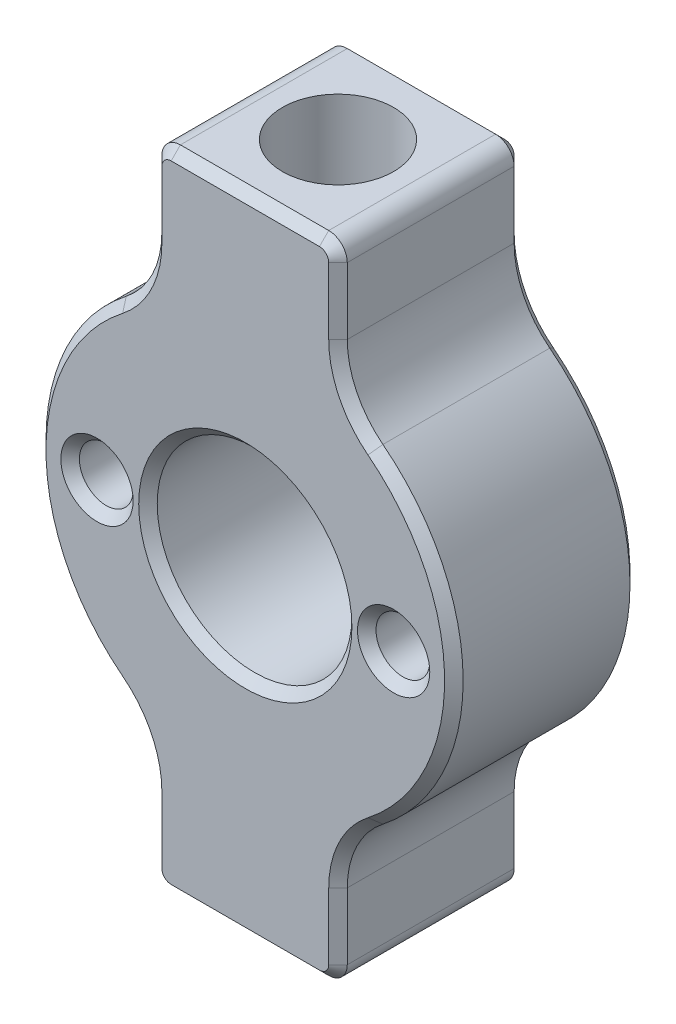
from build123d import *

# Parameters (mm, degrees)
SKIZZE1_R                       = 11.25
SKIZZE1_R_2                     = 5.25
AUFSATZ_LINEAR_AUSTRAGEN1_DEPTH = 10
AUFSATZ_LINEAR_START            = 6
SKIZZE2_W                       = 10
SKIZZE2_H                       = 10
AUFSATZ_LINEAR_AUSTRAGEN2_DEPTH = 11.4
SKIZZE3_R                       = 3
SCHNITT_LINEAR_AUSTRAGEN1_DEPTH = 10
SKIZZE4_R                       = 1.45
SCHNITT_LINEAR_AUSTRAGEN2_DEPTH = 8
VERRUNDUNG2_R                   = 5
VERRUNDUNG1_R                   = 1
FASE1_SIZE                      = 0.5


with BuildPart() as part:
    # Skizze1 → Aufsatz-Linear austragen1 (new body)
    with BuildSketch(Plane.XY):
        Circle(SKIZZE1_R)
        Circle(SKIZZE1_R_2, mode=Mode.SUBTRACT)
    extrude(amount=AUFSATZ_LINEAR_AUSTRAGEN1_DEPTH)

    # Skizze2 → Aufsatz-Linear austragen2 (add)
    with BuildSketch(Plane(origin=(0, 0, 0), x_dir=(1, 0, 0), z_dir=(0, 1, 0)).offset(AUFSATZ_LINEAR_START)):
        with Locations((0, -5)):
            Rectangle(SKIZZE2_W, SKIZZE2_H)
    aufsatz_linear_austragen2 = extrude(amount=AUFSATZ_LINEAR_AUSTRAGEN2_DEPTH)

    # Skizze3 → Schnitt-Linear austragen1 (cut)
    with BuildSketch(Plane(origin=(0, 17.4, 0), x_dir=(1, 0, 0), z_dir=(0, 1, 0))):
        with Locations((0, -5)):
            Circle(SKIZZE3_R)
    schnitt_linear_austragen1 = extrude(amount=-SCHNITT_LINEAR_AUSTRAGEN1_DEPTH, mode=Mode.SUBTRACT)

    # Spiegeln1: Aufsatz-Linear austragen2, Schnitt-Linear austragen1 across plane
    add(aufsatz_linear_austragen2.mirror(Plane.ZX))
    add(schnitt_linear_austragen1.mirror(Plane.ZX), mode=Mode.SUBTRACT)

    # Skizze4 → Schnitt-Linear austragen2 (cut)
    with BuildSketch(Plane.XY.offset(10)):
        with Locations((8, 0)):
            Circle(SKIZZE4_R)
        with Locations((-8, 0)):
            Circle(SKIZZE4_R)
    extrude(amount=-SCHNITT_LINEAR_AUSTRAGEN2_DEPTH, mode=Mode.SUBTRACT)

    # Verrundung2
    verrundung2_edges = [part.edges().sort_by_distance(p)[0] for p in [
        (-5, -10.077822185, 5),
        (-5, 10.077822185, 5),
        (5, 10.077822185, 5),
        (5, -10.077822185, 5),
    ]]
    fillet(verrundung2_edges, radius=VERRUNDUNG2_R)

    # Verrundung1
    verrundung1_edges = [part.edges().sort_by_distance(p)[0] for p in [
        (-5, 17.4, 5),
        (5, 17.4, 5),
        (5, -17.4, 5),
        (-5, -17.4, 5),
    ]]
    fillet(verrundung1_edges, radius=VERRUNDUNG1_R)

    # Fase1
    fase1_edges = [part.edges().sort_by_distance(p)[0] for p in [
        (-5.25, 0, 10),
        (-5, 14.604344229, 10),
        (0, 17.4, 10),
        (5, 14.604344229, 10),
        (5, -14.604344229, 10),
        (0, -17.4, 10),
        (-5, -14.604344229, 10),
        (-5.25, 0, 0),
        (5, 14.604344229, 0),
        (0, 17.4, 0),
        (-5, 14.604344229, 0),
        (-5, -14.604344229, 0),
        (0, -17.4, 0),
        (5, -14.604344229, 0),
        (5.506414829, 10.616043409, 10),
        (11.25, 0, 10),
        (5.506414829, -10.616043409, 10),
        (-5.506414829, -10.616043409, 10),
        (-11.25, 0, 10),
        (-5.506414829, 10.616043409, 10),
        (5.506414829, 10.616043409, 0),
        (-5.506414829, 10.616043409, 0),
        (-11.25, 0, 0),
        (-5.506414829, -10.616043409, 0),
        (5.506414829, -10.616043409, 0),
        (11.25, 0, 0),
        (-9.45, 0, 10),
        (6.55, 0, 10),
        (4.707106781, 17.107106781, 10),
        (4.707106781, -17.107106781, 10),
        (-4.707106781, -17.107106781, 10),
        (-4.707106781, 17.107106781, 10),
        (-4.707106781, -17.107106781, 0),
        (4.707106781, -17.107106781, 0),
        (4.707106781, 17.107106781, 0),
        (-4.707106781, 17.107106781, 0),
    ]]
    chamfer(fase1_edges, length=FASE1_SIZE)


solid = part.part
